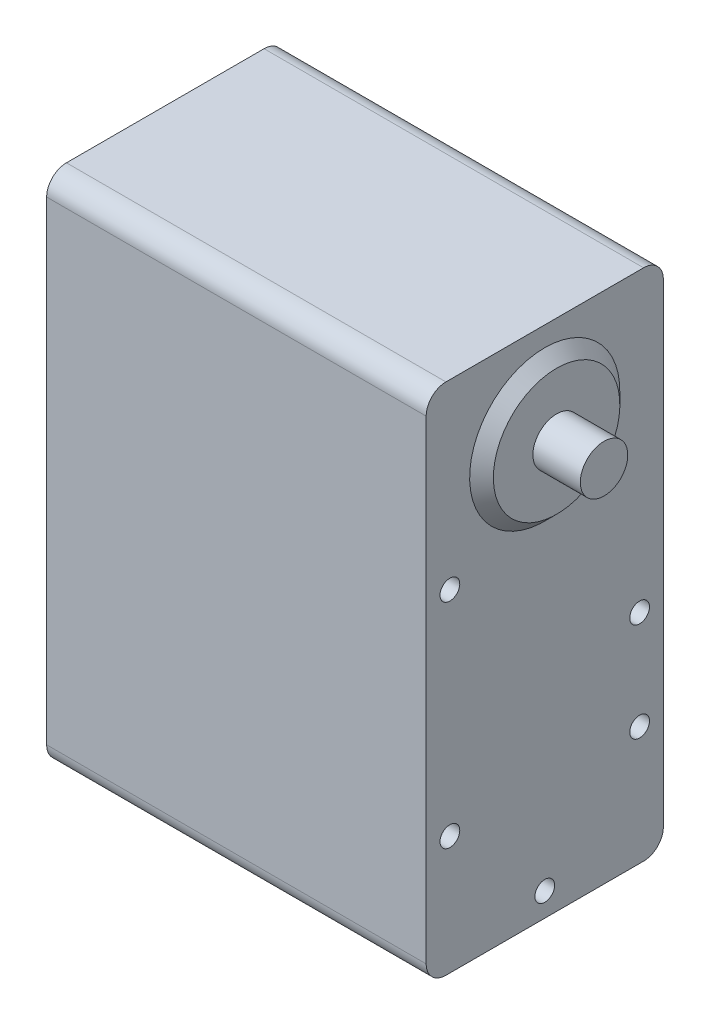
from build123d import *

# Parameters (mm, degrees)
BOSS_EXTRUDE1_DEPTH      = 15
BOSS_EXTRUDE1_DEPTH_BACK = 15
SKETCH1_W                = 48
SKETCH1_H                = 65
SKETCH2_R                = 1.25
CUT_EXTRUDE1_DEPTH       = 10
SKETCH4_R                = 9.5
SKETCH4_R_2              = 8
SKETCH4_R_3              = 3
BOSS_EXTRUDE3_DEPTH      = 1.5
CHAMFER2_SIZE            = 1.5
SKETCH5_R                = 3
BOSS_EXTRUDE4_DEPTH      = 6
CHAMFER2_OF_MIRROR1_SIZE = 1.5
SKETCH6_R                = 1.25
SKETCH6_R_2              = 1.249999994
CUT_EXTRUDE2_DEPTH       = 10
FILLET1_R                = 2.5


with BuildPart() as part:
    # Sketch1 → Boss-Extrude1 (new, two sides: drawn at the far end of the back side and taken through both)
    with BuildSketch(Plane.XY.offset(-BOSS_EXTRUDE1_DEPTH_BACK)):
        Rectangle(SKETCH1_W, SKETCH1_H)
    extrude(amount=BOSS_EXTRUDE1_DEPTH + BOSS_EXTRUDE1_DEPTH_BACK)

    # Sketch2 → Cut-Extrude1 (cut)
    with BuildSketch(Plane.ZY.offset(24)):
        with Locations(Location((-12, 29.5, 0), (0, 0, 270))):
            Circle(SKETCH2_R)
        with Locations(Location((12, 29.5, 0), (0, 0, 270))):
            Circle(SKETCH2_R)
        with Locations(Location((12, 5.5, 0), (0, 0, 270))):
            Circle(SKETCH2_R)
        with Locations(Location((-12, 5.5, 0), (0, 0, 270))):
            Circle(SKETCH2_R)
        with Locations(Location((-12, -29.5, 0), (0, 0, 270))):
            Circle(SKETCH2_R)
        with Locations(Location((12, -29.5, 0), (0, 0, 270))):
            Circle(SKETCH2_R)
    extrude(amount=-CUT_EXTRUDE1_DEPTH, mode=Mode.SUBTRACT)

    # Sketch4 → Boss-Extrude3 (add)
    # profile 1 of 3: a face of its own
    with BuildSketch(Plane.ZY.offset(24)):
        with Locations(Location((0, 20.5, 0), (0, 0, 270))):
            Circle(SKETCH4_R)
        with Locations((0, 20.5)):
            Circle(SKETCH4_R_2, mode=Mode.SUBTRACT)
    # profile 2 of 3: a face of its own
    with BuildSketch(Plane.ZY.offset(24)):
        with Locations((0, 20.5)):
            Circle(SKETCH4_R_2)
        with Locations((0, 20.5)):
            Circle(SKETCH4_R_3, mode=Mode.SUBTRACT)
    # profile 3 of 3: a face of its own
    with BuildSketch(Plane.ZY.offset(24)):
        with Locations((0, 20.5)):
            Circle(SKETCH4_R_3)
    boss_extrude3 = extrude(amount=BOSS_EXTRUDE3_DEPTH)

    # Chamfer2
    chamfer2_edges = [part.edges().sort_by_distance(p)[0] for p in [
        (-25.5, 30, 0),
    ]]
    chamfer(chamfer2_edges, length=CHAMFER2_SIZE - 0.0001)  # a hair under: the kernel refuses the full size

    # Sketch5 → Boss-Extrude4 (add)
    with BuildSketch(Plane.ZY.offset(25.5)):
        with Locations(Location((0, 20.5, 0), (0, 0, 270))):
            Circle(SKETCH5_R)
    boss_extrude4 = extrude(amount=BOSS_EXTRUDE4_DEPTH)

    # Mirror1: Boss-Extrude3, Boss-Extrude4 across plane
    add(boss_extrude3.mirror(Plane(origin=(0, 0, 0), x_dir=(0, 0, 1), z_dir=(1, 0, 0))))
    add(boss_extrude4.mirror(Plane(origin=(0, 0, 0), x_dir=(0, 0, 1), z_dir=(1, 0, 0))))

    # Chamfer2 of Mirror1
    chamfer2_of_mirror1_edges = [part.edges().sort_by_distance(p)[0] for p in [
        (25.5, 30, 0),
    ]]
    chamfer(chamfer2_of_mirror1_edges, length=CHAMFER2_OF_MIRROR1_SIZE - 0.0001)  # a hair under: the kernel refuses the full size

    # Sketch6 → Cut-Extrude2 (cut)
    with BuildSketch(Plane(origin=(24, 0, 0), x_dir=(0, 0, -1), z_dir=(1, 0, 0))):
        with Locations(Location((11.99999998, -5, 0), (0, 0, 90))):
            Circle(SKETCH6_R)
        with Locations(Location((12.00000002, -17.5, 0), (0, 0, 90))):
            Circle(SKETCH6_R)
        with Locations(Location((0, -29.5, 0), (0, 0, 90))):
            Circle(SKETCH6_R_2)
        with Locations(Location((-12.00000002, -17.5, 0), (0, 0, 90))):
            Circle(SKETCH6_R)
        with Locations(Location((-12.00000002, 9.5, 0), (0, 0, 90))):
            Circle(SKETCH6_R)
    extrude(amount=-CUT_EXTRUDE2_DEPTH, mode=Mode.SUBTRACT)

    # Fillet1
    fillet1_edges = [part.edges().sort_by_distance(p)[0] for p in [
        (0, -32.5, 15),
        (0, 32.5, 15),
        (0, 32.5, -15),
        (0, -32.5, -15),
    ]]
    fillet(fillet1_edges, radius=FILLET1_R)


solid = part.part
